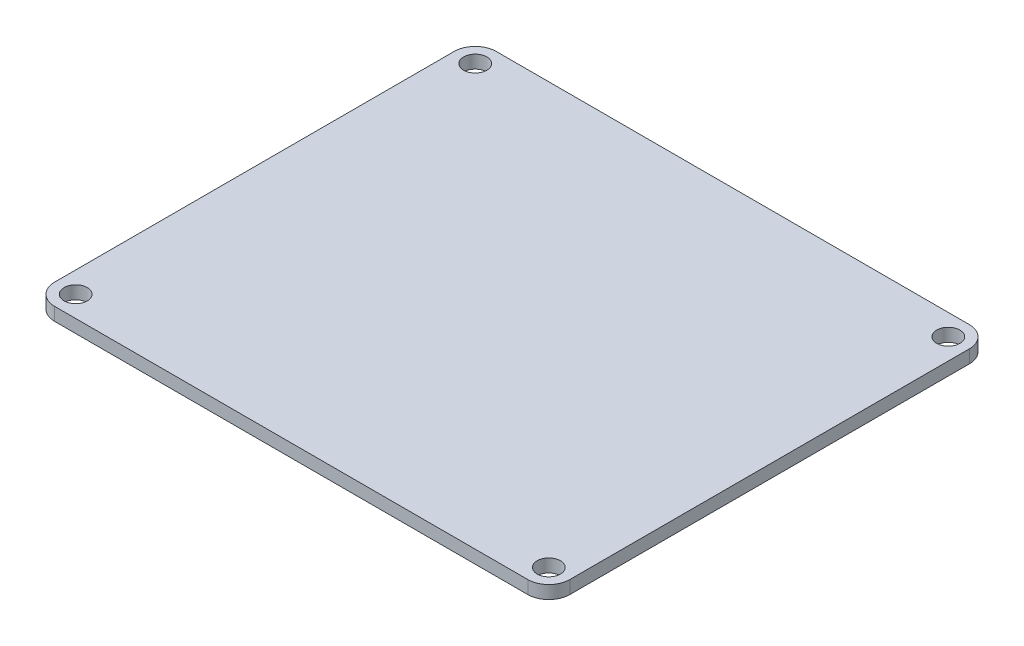
from build123d import *

# Parameters (mm, degrees)
SKETCH1_R           = 1.4
BOSS_EXTRUDE1_DEPTH = 1.5748


with BuildPart() as part:
    # Sketch1 → Boss-Extrude1 (new body)
    with BuildSketch(Plane(origin=(0, 0, 0), x_dir=(1, 0, 0), z_dir=(0, 1, 0))):
        with BuildLine():
            Line((-28.575, 26.67), (28.575, 26.67))
            ThreePointArc((28.575, 26.67), (30.371051224, 25.926051224), (31.115, 24.13))
            Line((31.115, 24.13), (31.115, -24.13))
            ThreePointArc((31.115, -24.13), (30.371051224, -25.926051224), (28.575, -26.67))
            Line((28.575, -26.67), (-28.575, -26.67))
            ThreePointArc((-28.575, -26.67), (-30.371051224, -25.926051224), (-31.115, -24.13))
            Line((-31.115, -24.13), (-31.115, 24.13))
            ThreePointArc((-31.115, 24.13), (-30.371051224, 25.926051224), (-28.575, 26.67))
        make_face()
        with Locations((-28.575, 24.13)):
            Circle(SKETCH1_R, mode=Mode.SUBTRACT)
        with Locations((28.575, 24.13)):
            Circle(SKETCH1_R, mode=Mode.SUBTRACT)
        with Locations((-28.575, -24.13)):
            Circle(SKETCH1_R, mode=Mode.SUBTRACT)
        with Locations((28.575, -24.13)):
            Circle(SKETCH1_R, mode=Mode.SUBTRACT)
    extrude(amount=BOSS_EXTRUDE1_DEPTH)


solid = part.part
